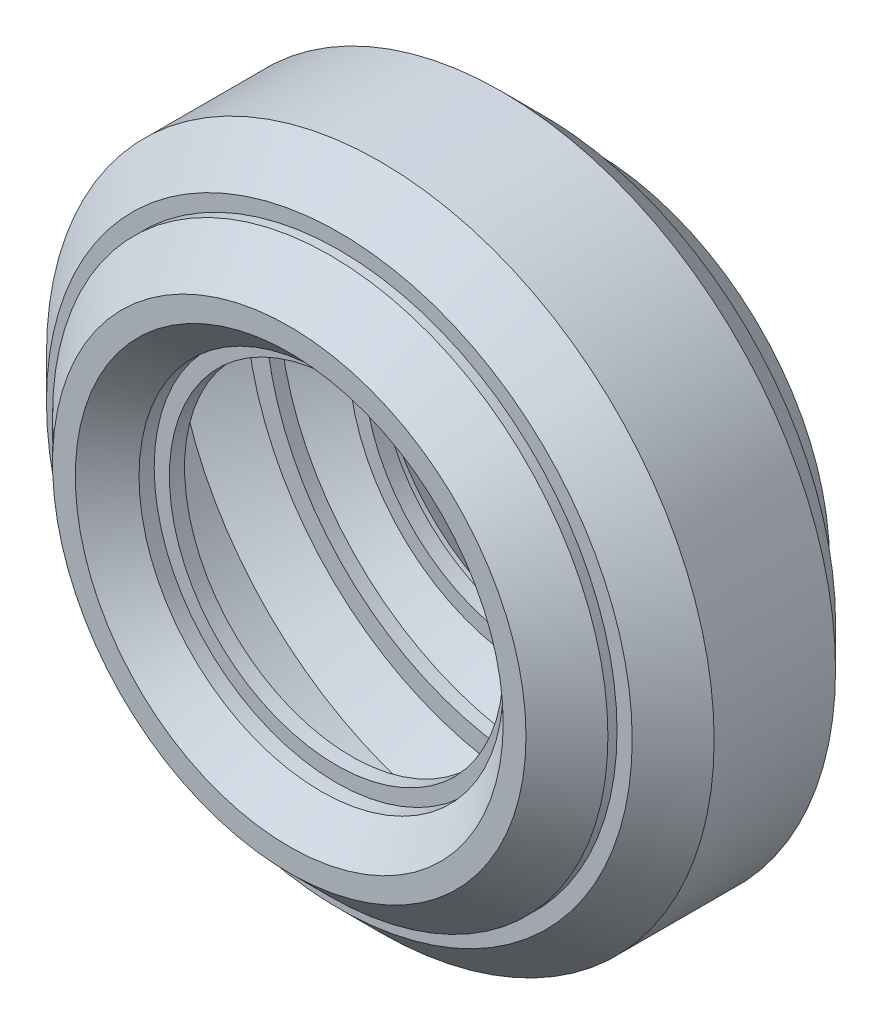
from build123d import *

# Parameters (mm, degrees)
EXTRUDE1_DEPTH      = 3.81
EXTRUDE2_DEPTH      = 0.508
CUT_EXTRUDE2_DEPTH  = 15.255714644
EXTRUDE3_DEPTH      = 3.302
EXTRUDE4_REACH      = 14.636
SKETCH9_W           = 3.553663376
SKETCH9_H           = 0.1905
SKETCH11_R          = 2.286
CUT_EXTRUDE3_DEPTH  = 13.636340451
SKETCH12_R          = 3.175
CUT_EXTRUDE4_DEPTH  = 0.508
SKETCH13_OUTSIDE_W  = 29.914
SKETCH13_OUTSIDE_H  = 14.674
SKETCH13_OUTSIDE_R  = 3.81
CUT_EXTRUDE5_DEPTH  = 15.255714644
CUT_EXTRUDE7_START  = 6.604
CUT_EXTRUDE7_DEPTH  = 6.604
SCALE1_SCALE_X      = 1
SCALE1_SCALE_Y      = 1
SCALE1_SCALE_Z      = 2.633333333
EXTRUDE6_DEPTH      = 30.24890252
EXTRUDE6_DEPTH_BACK = 30.24890252
SKETCH20_R          = 2.286
SKETCH21_R          = 12.7
SKETCH21_R_2        = 3.81
EXTRUDE7_DEPTH      = 10.16
EXTRUDE7_TAPER      = 35


# Read off the part's stored shape, not the designer's step: Shell1
with BuildPart() as part:
    # Sketch1 → Extrude1 (new body)
    with BuildSketch(Plane(origin=(0, 0, 0), x_dir=(1, 0, 0), z_dir=(0, 1, 0))):
        with BuildLine():
            Line((-7.62, 3.81), (0, 3.81))
            ThreePointArc((0, 3.81), (3.81, 0), (0, -3.81))
            Line((0, -3.81), (-7.62, -3.81))
            ThreePointArc((-7.62, -3.81), (-11.43, 0), (-7.62, 3.81))
        make_face()
    extrude(amount=EXTRUDE1_DEPTH)

    # Sketch4 → Extrude2 (add)
    with BuildSketch(Plane.XY.offset(3.81)):
        with BuildLine():
            Line((0, 0), (0, 3.81))
            Line((0, 3.81), (7.62, 3.81))
            ThreePointArc((7.62, 3.81), (10.314076836, 2.694076836), (11.43, 0))
            Line((11.43, 0), (7.62, 0))
            Line((7.62, 0), (0, 0))
        make_face()
    extrude2 = extrude(amount=-EXTRUDE2_DEPTH)

    # Sketch6 → Cut-Extrude2 (cut, through all)
    with BuildSketch(Plane.XY.offset(3.81)):
        with BuildLine():
            Line((6.858, 2.032), (6.858, 1.016))
            ThreePointArc((6.858, 1.016), (6.783605122, 0.836394878), (6.604, 0.762))
            Line((6.604, 0.762), (5.588, 0.762))
            ThreePointArc((5.588, 0.762), (5.408394878, 0.687605122), (5.334, 0.508))
            Line((5.334, 0.508), (5.334, -0.508))
            ThreePointArc((5.334, -0.508), (5.408394878, -0.687605122), (5.588, -0.762))
            Line((5.588, -0.762), (6.604, -0.762))
            ThreePointArc((6.604, -0.762), (6.783605122, -0.836394878), (6.858, -1.016))
            Line((6.858, -1.016), (6.858, -2.032))
            ThreePointArc((6.858, -2.032), (6.932394878, -2.211605122), (7.112, -2.286))
            Line((7.112, -2.286), (8.128, -2.286))
            ThreePointArc((8.128, -2.286), (8.307605122, -2.211605122), (8.382, -2.032))
            Line((8.382, -2.032), (8.382, -1.016))
            ThreePointArc((8.382, -1.016), (8.456394878, -0.836394878), (8.636, -0.762))
            Line((8.636, -0.762), (9.652, -0.762))
            ThreePointArc((9.652, -0.762), (9.831605122, -0.687605122), (9.906, -0.508))
            Line((9.906, -0.508), (9.906, 0.508))
            ThreePointArc((9.906, 0.508), (9.831605122, 0.687605122), (9.652, 0.762))
            Line((9.652, 0.762), (8.636, 0.762))
            ThreePointArc((8.636, 0.762), (8.456394878, 0.836394878), (8.382, 1.016))
            Line((8.382, 1.016), (8.382, 2.032))
            ThreePointArc((8.382, 2.032), (8.307605122, 2.211605122), (8.128, 2.286))
            Line((8.128, 2.286), (7.112, 2.286))
            ThreePointArc((7.112, 2.286), (6.932394878, 2.211605122), (6.858, 2.032))
        make_face()
    cut_extrude2 = extrude(amount=-CUT_EXTRUDE2_DEPTH, mode=Mode.SUBTRACT)

    # Sketch8 → Extrude3 (add)
    with BuildSketch(Plane(origin=(0, 0, 3.302), x_dir=(-1, 0, 0), z_dir=(0, 0, -1))):
        with BuildLine():
            Line((-10.795, 0), (-10.414, 0))
            ThreePointArc((-10.414, 0), (-9.726056742, 1.836017701), (-8.001, 2.767900829))
            Line((-8.001, 2.767900829), (-8.001, 3.152057106))
            ThreePointArc((-8.001, 3.152057106), (-9.995952441, 2.106056742), (-10.795, 0))
        make_face()
        with BuildLine():
            Line((-4.826, 0), (-4.445, 0))
            ThreePointArc((-4.445, 0), (-5.244047559, 2.106056742), (-7.239, 3.152057106))
            Line((-7.239, 3.152057106), (-7.239, 2.767900829))
            ThreePointArc((-7.239, 2.767900829), (-5.513943258, 1.836017701), (-4.826, 0))
        make_face()
    extrude3 = extrude(amount=EXTRUDE3_DEPTH)

    # Sketch9 → Extrude4 (add, up to next)
    with BuildSketch(Plane(origin=(0, 0, 0), x_dir=(-1, 0, 0), z_dir=(0, 0, -1)), mode=Mode.PRIVATE) as extrude4_sk1:
        with Locations((-2.858668312, 0.09525)):
            Rectangle(SKETCH9_W, SKETCH9_H)
    extrude4_tool1 = extrude(extrude4_sk1.sketch, amount=-EXTRUDE4_REACH, mode=Mode.PRIVATE) - part.part
    extrude4 = extrude4_tool1.solids().sort_by_distance((2.858668, 0.09525, 0))[0]
    add(extrude4)

    # Mirror5: Extrude2, Cut-Extrude2, Extrude3, Extrude4 across plane
    add(extrude2.mirror(Plane(origin=(7.62, 0, 0), x_dir=(1, 0, 0), z_dir=(0, 0, -1))))
    add(cut_extrude2.mirror(Plane(origin=(7.62, 0, 0), x_dir=(1, 0, 0), z_dir=(0, 0, -1))), mode=Mode.SUBTRACT)
    add(extrude3.mirror(Plane(origin=(7.62, 0, 0), x_dir=(1, 0, 0), z_dir=(0, 0, -1))))
    add(extrude4.mirror(Plane(origin=(7.62, 0, 0), x_dir=(1, 0, 0), z_dir=(0, 0, -1))))

    # Sketch11 → Cut-Extrude3 (cut, through all)
    with BuildSketch(Plane(origin=(0, 3.81, 0), x_dir=(1, 0, 0), z_dir=(0, 1, 0))):
        with Locations(Location((0, 0, 0), (0, 0, 270))):
            Circle(SKETCH11_R)
        with Locations(Location((-7.62, 0, 0), (0, 0, 270))):
            Circle(SKETCH11_R)
    extrude(amount=-CUT_EXTRUDE3_DEPTH, mode=Mode.SUBTRACT)

    # Sketch12 → Cut-Extrude4 (cut)
    with BuildSketch(Plane(origin=(0, 3.81, 0), x_dir=(1, 0, 0), z_dir=(0, 1, 0))):
        with Locations(Location((0, 0, 0), (0, 0, 270))):
            Circle(SKETCH12_R)
        with Locations(Location((-7.62, 0, 0), (0, 0, 270))):
            Circle(SKETCH12_R)
    extrude(amount=-CUT_EXTRUDE4_DEPTH, mode=Mode.SUBTRACT)

    # Mirror6: part across face


with BuildPart() as part_1:
    add(part.part)
    add(part.part.mirror(Plane(origin=(-2.524422527, 0, 0), x_dir=(0, 0, 1), z_dir=(0, -1, 0))))

    # Sketch13 outside → Cut-Extrude5 (cut, through all)
    with BuildSketch(Plane.XY.offset(3.81)):
        Rectangle(SKETCH13_OUTSIDE_W, SKETCH13_OUTSIDE_H)
        with Locations((7.62, 0)):
            Circle(SKETCH13_OUTSIDE_R, mode=Mode.SUBTRACT)
    extrude(amount=-CUT_EXTRUDE5_DEPTH, mode=Mode.SUBTRACT)

    # Sketch15 → Cut-Extrude7 (cut)
    with BuildSketch(Plane.XY.offset(-3.302).offset(CUT_EXTRUDE7_START)):
        with BuildLine():
            Line((4.486048338, 2.166667252), (5.299185915, 2.166667252))
            ThreePointArc((5.299185915, 2.166667252), (4.44500552, -0.00592023), (5.307282146, -2.175307134))
            Line((5.307282146, -2.175307134), (4.492039183, -2.175307134))
            ThreePointArc((4.492039183, -2.175307134), (3.810003627, -0.005256847), (4.486048338, 2.166667252))
        make_face()
    extrude(amount=-CUT_EXTRUDE7_DEPTH, mode=Mode.SUBTRACT)


with BuildPart() as part_2:
    # Scale1: scaled about (0, 0, 0)
    add(part_1.part.scale((SCALE1_SCALE_X, SCALE1_SCALE_Y, SCALE1_SCALE_Z), about=(0, 0, 0)))

    # Sketch17 → Revolve1 (revolve)
    with BuildSketch(Plane(origin=(0, 0, 0), x_dir=(1, 0, 0), z_dir=(0, 1, 0))):
        Polygon((10.414, 10.033), (10.414, -10.033), (22.86, -10.033), (22.86, -8.763), (21.59, -8.763), (21.59, -7.493), (22.86, -7.493), (22.86, -6.223), (21.59, -2.54), (21.59, 2.54), (22.86, 6.223), (22.86, 7.493), (21.59, 7.493), (21.59, 8.763), (22.86, 8.763), (22.86, 10.033), align=None)
    revolve(axis=Axis((7.62, 0, 0), (0, 0, -1)))

    # Sketch20 → Extrude6 (cut, two sides: drawn at the far end of the back side and taken through both)
    with BuildSketch(Plane.XY.offset(-EXTRUDE6_DEPTH_BACK)):
        with Locations((7.62, 7.62)):
            Circle(SKETCH20_R)
        with Locations((14.219113577, 3.81)):
            Circle(SKETCH20_R)
        with Locations((14.219113577, -3.81)):
            Circle(SKETCH20_R)
        with Locations((7.62, -7.62)):
            Circle(SKETCH20_R)
        with Locations((1.020886423, -3.81)):
            Circle(SKETCH20_R)
        with Locations((1.020886423, 3.81)):
            Circle(SKETCH20_R)
    extrude(amount=EXTRUDE6_DEPTH + EXTRUDE6_DEPTH_BACK, mode=Mode.SUBTRACT)

    # Sketch21 → Extrude7 (cut)
    with BuildSketch(Plane.XY.offset(10.033)):
        with Locations((7.62, 0)):
            Circle(SKETCH21_R)
        with Locations((7.62, 0)):
            Circle(SKETCH21_R_2, mode=Mode.SUBTRACT)
    extrude7 = extrude(amount=-EXTRUDE7_DEPTH, taper=EXTRUDE7_TAPER, mode=Mode.SUBTRACT)

    # Mirror7: Extrude7 across plane
    add(extrude7.mirror(Plane.XY), mode=Mode.SUBTRACT)


with BuildPart() as body_2:
    # Sketch22 → Revolve2 (revolve)
    with BuildSketch(Plane(origin=(0, 0, 0), x_dir=(1, 0, 0), z_dir=(0, 1, 0))):
        Polygon((22.86, -8.763), (22.86, -10.033), (25.527, -12.7), (27.432, -12.7), (30.861, -9.271), (30.861, -8.509), (32.131, -8.509), (35.56, -5.08), (35.56, 5.08), (32.131, 8.509), (30.861, 8.509), (30.861, 9.271), (27.432, 12.7), (25.527, 12.7), (22.86, 10.033), (22.86, 8.763), (21.59, 8.763), (21.59, 7.493), (22.86, 7.493), (22.86, 6.223), (21.59, 2.54), (21.59, -2.54), (22.86, -6.223), (22.86, -7.493), (21.59, -7.493), (21.59, -8.763), align=None)
    revolve(axis=Axis((7.62, 0, 0), (0, 0, -1)))

    # Shell1 outline → Shell1 (revolve, cut)
    with BuildSketch(Plane(origin=(7.62, 0, 0), x_dir=(1, 0, 0), z_dir=(0, -1, 0))):
        Polygon((15.24, -8.128), (15.875, -8.128), (15.875, -9.769974388), (18.170025612, -12.065), (19.548974388, -12.065), (22.606, -9.007974388), (22.606, -7.874), (24.247974388, -7.874), (27.305, -4.816974388), (27.305, 4.816974388), (24.247974388, 7.874), (22.606, 7.874), (22.606, 9.007974388), (19.548974388, 12.065), (18.170025612, 12.065), (15.875, 9.769974388), (15.875, 8.128), (15.24, 8.128), (15.24, 6.223), (13.97, 2.54), (13.97, -2.54), (15.24, -6.223), align=None)
    revolve(axis=Axis((7.62, 0, 0), (0, 0, 1)), mode=Mode.SUBTRACT)


solid = body_2.part
